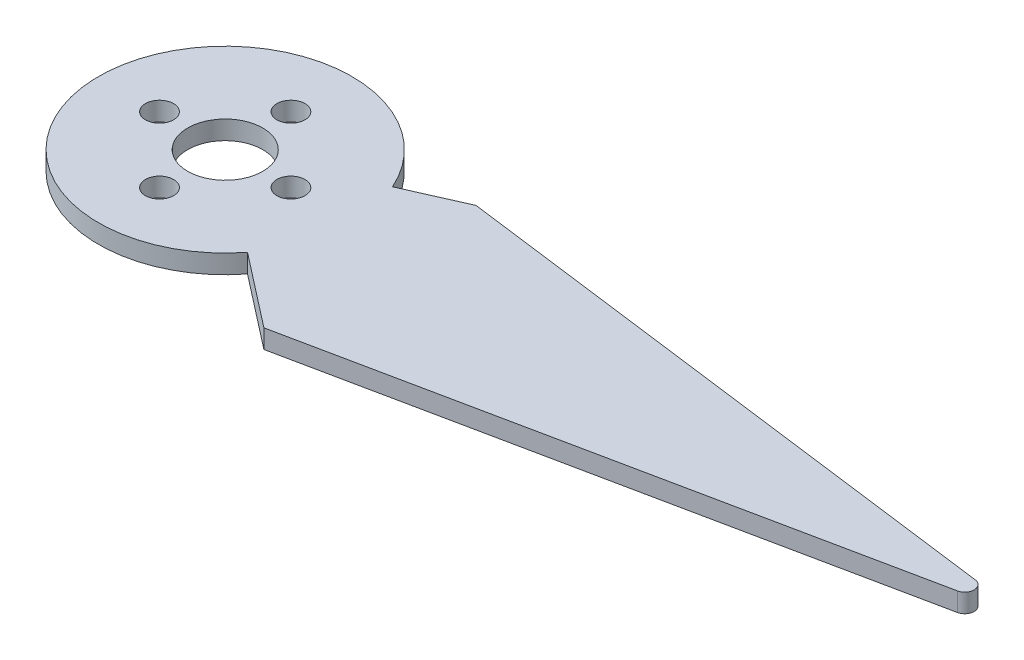
from build123d import *

# Parameters (mm, degrees)
BRIDA_BASE1_DEPTH     = 2
CROQUIS12_R           = 4
CORTAR_EXTRUIR1_DEPTH = 2
CROQUIS13_R           = 1.5
CORTAR_EXTRUIR2_DEPTH = 2
MATRIZC1_COUNT        = 4


# Sheet-metal steps are written as plain solids
with BuildPart() as part:
    # Croquis7 → Brida base1 (new body)
    with BuildSketch(Plane(origin=(0, 0, 0), x_dir=(1, 0, 0), z_dir=(0, 1, 0))):
        with BuildLine():
            Line((10.659249118, -8.284752463), (18.5, -14.378866547))
            Line((18.5, -14.378866547), (79.710147148, -1.70472983))
            ThreePointArc((79.710147148, -1.70472983), (80.506688025, -0.68807512), (79.636333375, 0.266150717))
            Line((79.636333375, 0.266150717), (18.5, 8.215724958))
            Line((18.5, 8.215724958), (12.337716326, 5.480645126))
            ThreePointArc((12.337716326, 5.480645126), (-13.400994276, 1.634034128), (10.659249118, -8.284752463))
        make_face()
    extrude(amount=-BRIDA_BASE1_DEPTH)

    # Croquis12 → Cortar-Extruir1 (cut)
    with BuildSketch(Plane(origin=(0, 0, 0), x_dir=(1, 0, 0), z_dir=(0, 1, 0))):
        with Locations(Location((0, 0, 0), (0, 0, 270))):
            Circle(CROQUIS12_R)
    extrude(amount=-CORTAR_EXTRUIR1_DEPTH, mode=Mode.SUBTRACT)

    # Croquis13 → Cortar-Extruir2 (cut)
    with BuildSketch(Plane(origin=(0, 0, 0), x_dir=(1, 0, 0), z_dir=(0, 1, 0))):
        with Locations(Location((0, 7, 0), (0, 0, 270))):
            Circle(CROQUIS13_R)
    cortar_extruir2 = extrude(amount=-CORTAR_EXTRUIR2_DEPTH, mode=Mode.SUBTRACT)

    # MatrizC1: Cortar-Extruir2 ×4 about axis
    matrizc1_axis = Axis((0, 0, 0), (0, 1, 0))
    for i in range(1, MATRIZC1_COUNT):
        add(cortar_extruir2.rotate(matrizc1_axis, i * 360 / MATRIZC1_COUNT), mode=Mode.SUBTRACT)


solid = part.part
